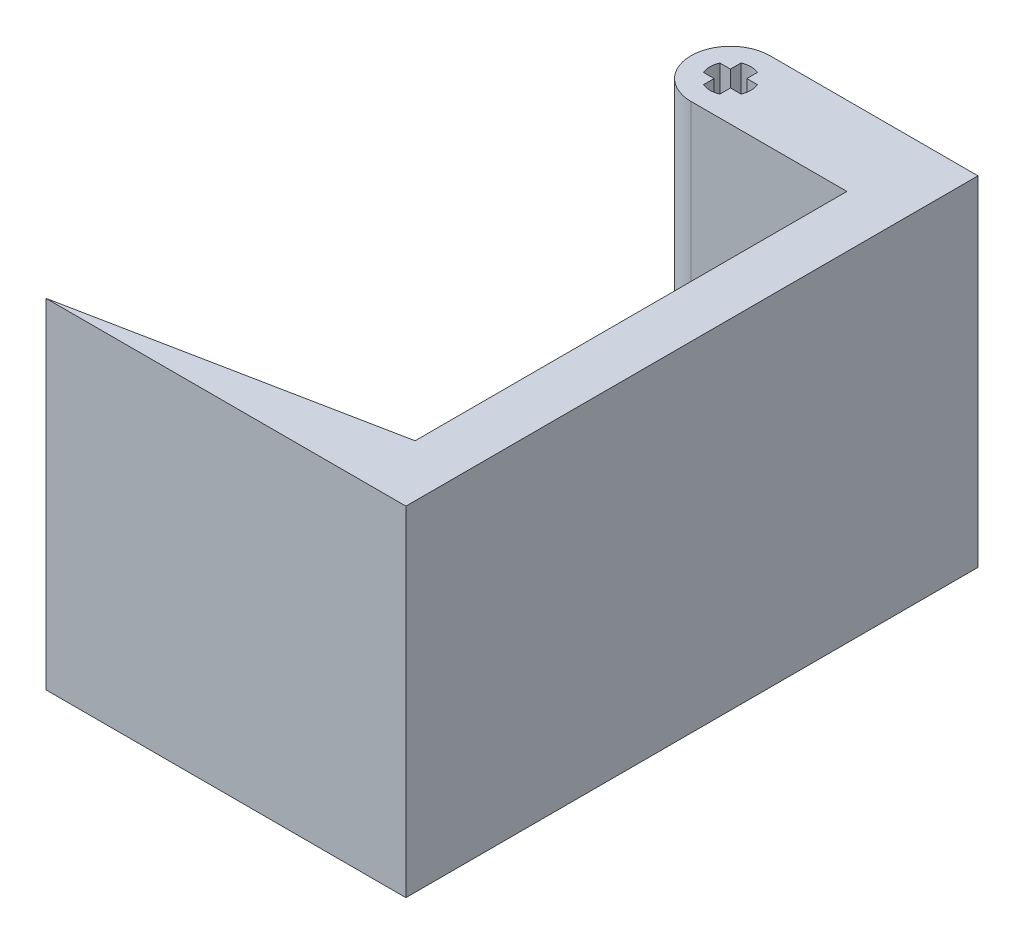
from build123d import *

# Parameters (mm, degrees)
BOSS_EXTRUDE6_DEPTH = 41.402


with BuildPart() as part:
    # Sketch1 → Boss-Extrude6 (new body)
    with BuildSketch(Plane(origin=(0, 0, 0), x_dir=(1, 0, 0), z_dir=(0, 1, 0))):
        with BuildLine():
            Line((25.4, 4.826), (0, 4.826))
            ThreePointArc((0, 4.826), (-4.826, 0), (0, -4.826))
            Line((0, -4.826), (19.05, -4.826))
            Line((19.05, -4.826), (19.05, -57.550565519))
            Line((19.05, -57.550565519), (-18.542, -65.024))
            Line((-18.542, -65.024), (25.4, -65.024))
            Line((25.4, -65.024), (25.4, 4.826))
        make_face()
        with BuildLine():
            Line((-1, 1), (-2.291287847, 1))
            ThreePointArc((-2.291287847, 1), (-2.5, 0), (-2.291287847, -1))
            Line((-2.291287847, -1), (-1, -1))
            Line((-1, -1), (-1, -2.291287847))
            ThreePointArc((-1, -2.291287847), (0, -2.5), (1, -2.291287847))
            Line((1, -2.291287847), (1, -1))
            Line((1, -1), (2.291287847, -1))
            ThreePointArc((2.291287847, -1), (2.5, 0), (2.291287847, 1))
            Line((2.291287847, 1), (1, 1))
            Line((1, 1), (1, 2.291287847))
            ThreePointArc((1, 2.291287847), (0, 2.5), (-1, 2.291287847))
            Line((-1, 2.291287847), (-1, 1))
        make_face(mode=Mode.SUBTRACT)
    extrude(amount=BOSS_EXTRUDE6_DEPTH)


solid = part.part
